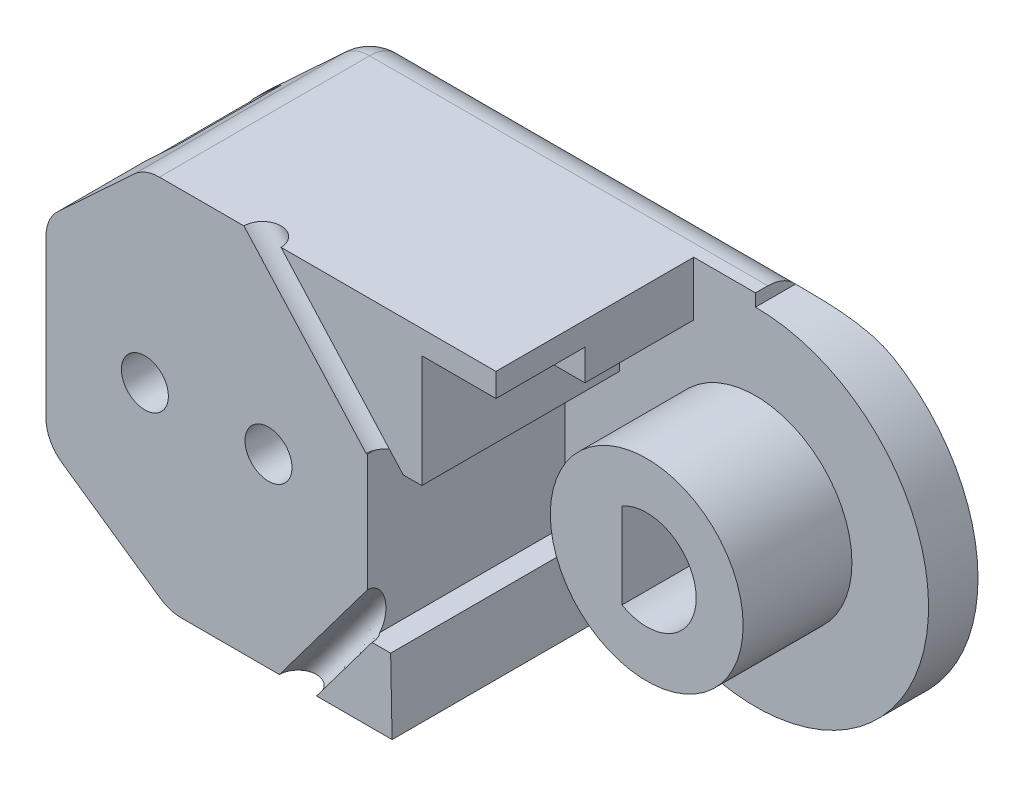
from build123d import *

# Parameters (mm, degrees)
BOSS_EXTRUDE1_DEPTH      = 2
BOSS_EXTRUDE2_DEPTH      = 8
SKETCH24_R               = 3.9
BOSS_EXTRUDE5_DEPTH      = 4.4
SKETCH30_W               = 4.40861202
SKETCH30_H               = 1.324178481
CUT_EXTRUDE12_DEPTH      = 16
CUT_EXTRUDE11_DEPTH      = 23.928148639
FILLET1_R                = 1.5
SKETCH34_R               = 0.75
CUT_EXTRUDE13_DEPTH      = 8
SKETCH35_R               = 0.75
CUT_EXTRUDE14_DEPTH      = 3
CUT_EXTRUDE14_DEPTH_BACK = 8
SKETCH36_R               = 0.95
CUT_EXTRUDE15_DEPTH      = 8
SKETCH37_R               = 2
CUT_EXTRUDE16_DEPTH      = 4.5
SKETCH38_W               = 3
SKETCH38_H               = 1.25
CUT_EXTRUDE17_DEPTH      = 3.6


with BuildPart() as part:
    # Sketch2 → Boss-Extrude1 (new body)
    with BuildSketch(Plane.XY):
        with BuildLine():
            Line((-2.5, 7.5), (-16.7, 7.5))
            Line((-16.7, 7.5), (-20.7, 3.793442666))
            Line((-20.7, 3.793442666), (-20.7, -4.031648778))
            Line((-20.7, -4.031648778), (-15.7, -7.5))
            Line((-15.7, -7.5), (-6.7, -7.5))
            Line((-6.7, -7.5), (-4.2, -5.6))
            ThreePointArc((-4.2, -5.6), (3.130495168, -6.260990337), (7, 0))
            ThreePointArc((7, 0), (4.949747468, 4.949747468), (0, 7))
            Line((0, 7), (0, 7.5))
            Line((0, 7.5), (-2.5, 7.5))
        make_face()
    extrude(amount=BOSS_EXTRUDE1_DEPTH)

    # Sketch4 → Boss-Extrude2 (add)
    with BuildSketch(Plane.XY.offset(2)):
        Polygon((-15.7, -7.5), (-6.7, -7.5), (-6.759079174, -4.5), (-7.7, -4.5), (-7.7, 2), (-5.5, 2), (-5.5, 5.3), (-2.5, 5.3), (-2.5, 7.5), (-16.7, 7.5), (-20.7, 3.793442666), (-20.7, -4.031648778), align=None)
    extrude(amount=BOSS_EXTRUDE2_DEPTH)

    # Sketch24 → Boss-Extrude5 (add)
    with BuildSketch(Plane.XY.offset(2)):
        Circle(SKETCH24_R)
    extrude(amount=BOSS_EXTRUDE5_DEPTH)

    # Sketch30 → Cut-Extrude12 (cut)
    with BuildSketch(Plane(origin=(-5.5, 0, 0), x_dir=(0, 0, -1), z_dir=(1, 0, 0))):
        with Locations((-4.20430601, 4.63791076)):
            Rectangle(SKETCH30_W, SKETCH30_H)
    extrude(amount=-CUT_EXTRUDE12_DEPTH, mode=Mode.SUBTRACT)

    # Sketch28 → Cut-Extrude11 (cut, through all)
    with BuildSketch(Plane.XY.offset(6.4)):
        with BuildLine():
            Line((-1, 1.732050808), (-1, -1.732050808))
            ThreePointArc((-1, -1.732050808), (2, 0), (-1, 1.732050808))
        make_face()
    extrude(amount=-CUT_EXTRUDE11_DEPTH, mode=Mode.SUBTRACT)

    # Fillet1
    # the kernel refuses this fillet: 1.5 mm, written as the material it takes off along each edge
    with BuildSketch(Plane(origin=(-15.230677435, -6, 1.5), x_dir=(-0.5699665637840448, -0.8216678867816415, 0), z_dir=(0, 0, -1))) as fillet1_piece_1_section:
        Polygon((0, 0), (FILLET1_R * 1.02, 0), (FILLET1_R * 1.02, -FILLET1_R * 0.319139344377), (FILLET1_R * 0.838101244517, -FILLET1_R * 0.58136589506), align=None)
    fillet1_piece_1 = extrude(amount=FILLET1_R * 1.02, mode=Mode.PRIVATE)
    fillet1_piece_1 = fillet1_piece_1 - Plane(origin=(-15.230677435, -6, 1.5), x_dir=(0.29860685961507855, 0.9543762064253388, 0), z_dir=(0, 0, -1)) * Sphere(FILLET1_R, mode=Mode.PRIVATE)
    add(fillet1_piece_1, mode=Mode.SUBTRACT)
    with BuildSketch(Plane(origin=(-16.11186344, 6, 1.5), x_dir=(-0.6796897201843015, 0.7334997506991983, 0), z_dir=(0, 0, -1))) as fillet1_piece_2_section:
        Polygon((0, 0), (FILLET1_R * 1.02, 0), (FILLET1_R * 1.02, FILLET1_R * 0.399932860855), (FILLET1_R * 0.748169745713, FILLET1_R * 0.693283514588), align=None)
    fillet1_piece_2 = extrude(amount=FILLET1_R * 1.02, mode=Mode.PRIVATE)
    fillet1_piece_2 = fillet1_piece_2 - Plane(origin=(-16.11186344, 6, 1.5), x_dir=(0.3650344157067945, -0.9309940254102596, 0), z_dir=(0, 0, -1)) * Sphere(FILLET1_R, mode=Mode.PRIVATE)
    add(fillet1_piece_2, mode=Mode.SUBTRACT)
    with BuildSketch(Plane(origin=(-19.2, 3.138411196, 1.5), x_dir=(-0.6796897201843015, 0.7334997506991983, 0), z_dir=(0, 0, -1))) as fillet1_piece_3_section:
        Polygon((0, 0), (FILLET1_R * 1.02, 0), (FILLET1_R * 1.02, -FILLET1_R * 0.445421399395), (FILLET1_R * 0.693283514588, -FILLET1_R * 0.748169745713), align=None)
    fillet1_piece_3 = extrude(amount=FILLET1_R * 1.02, mode=Mode.PRIVATE)
    fillet1_piece_3 = fillet1_piece_3 - Plane(origin=(-19.2, 3.138411196, 1.5), x_dir=(0.9164304993244992, -0.40019387789901173, 0), z_dir=(0, 0, -1)) * Sphere(FILLET1_R, mode=Mode.PRIVATE)
    add(fillet1_piece_3, mode=Mode.SUBTRACT)
    with BuildSketch(Plane(origin=(-19.2, -3.246599046, 1.5), x_dir=(-0.5699665637840448, -0.8216678867816415, 0), z_dir=(0, 0, -1))) as fillet1_piece_4_section:
        Polygon((0, 0), (FILLET1_R * 1.02, 0), (FILLET1_R * 1.02, FILLET1_R * 0.533833817771), (FILLET1_R * 0.58136589506, FILLET1_R * 0.838101244517), align=None)
    fillet1_piece_4 = extrude(amount=FILLET1_R * 1.02, mode=Mode.PRIVATE)
    fillet1_piece_4 = fillet1_piece_4 - Plane(origin=(-19.2, -3.246599046, 1.5), x_dir=(0.8859928227090906, 0.46369895202380795, 0), z_dir=(0, 0, -1)) * Sphere(FILLET1_R, mode=Mode.PRIVATE)
    add(fillet1_piece_4, mode=Mode.SUBTRACT)
    with BuildSketch(Plane(origin=(-15.230677435, -7.5, 0), x_dir=(0, 1, 0), z_dir=(1, 0, 0))) as fillet1_piece_5_section:
        with BuildLine():
            CenterArc((FILLET1_R, FILLET1_R), FILLET1_R, 180, 90)
            Line((0, FILLET1_R), (0, 0))
            Line((0, 0), (FILLET1_R, 0))
        make_face()
    fillet1_piece_5 = extrude(amount=12.280677435, mode=Mode.PRIVATE)
    fillet1_piece_5 = split(fillet1_piece_5, bisect_by=Plane(origin=(-9.092127217, -9.318016685, 0.3282266), z_dir=(-0.6050832675335577, 0.7961621941231027, 0)), keep=Keep.TOP, mode=Mode.PRIVATE)
    add(fillet1_piece_5, mode=Mode.SUBTRACT)
    with BuildSketch(Plane(origin=(3.75, 7.5, 0), x_dir=(0, 0, 1), z_dir=(-1, 0, 0))) as fillet1_piece_6:
        with BuildLine():
            CenterArc((FILLET1_R, -FILLET1_R), FILLET1_R, 90, 90)
            Line((0, -FILLET1_R), (0, 0))
            Line((0, 0), (FILLET1_R, 0))
        make_face()
    extrude(amount=19.86186344, mode=Mode.SUBTRACT)
    with BuildSketch(Plane(origin=(-17.13139802, 7.100249626, 0), x_dir=(0.6796897201843014, -0.7334997506991981, 0), z_dir=(-0.7334997506991983, -0.6796897201843015, 0))) as fillet1_piece_7:
        with BuildLine():
            CenterArc((FILLET1_R, FILLET1_R), FILLET1_R, 180, 90)
            Line((0, FILLET1_R), (0, 0))
            Line((0, 0), (FILLET1_R, 0))
        make_face()
    extrude(amount=4.21013989, mode=Mode.SUBTRACT)
    with BuildSketch(Plane(origin=(-20.054949846, -4.479100876, 0), x_dir=(0.5699665637840448, 0.8216678867816416, 0), z_dir=(0.8216678867816415, -0.5699665637840448, 0))) as fillet1_piece_8:
        with BuildLine():
            CenterArc((FILLET1_R, FILLET1_R), FILLET1_R, 180, 90)
            Line((0, FILLET1_R), (0, 0))
            Line((0, 0), (FILLET1_R, 0))
        make_face()
    extrude(amount=4.830811364, mode=Mode.SUBTRACT)
    with BuildSketch(Plane(origin=(-20.7, 3.138411196, 0), x_dir=(1, 0, 0), z_dir=(0, -1, 0))) as fillet1_piece_9:
        with BuildLine():
            CenterArc((FILLET1_R, FILLET1_R), FILLET1_R, 180, 90)
            Line((0, FILLET1_R), (0, 0))
            Line((0, 0), (FILLET1_R, 0))
        make_face()
    extrude(amount=6.385010242, mode=Mode.SUBTRACT)
    with BuildSketch(Plane(origin=(-15.7, -7.5, 1.5), x_dir=(1, 0, 0), z_dir=(0, 0, 1))) as fillet1_piece_10:
        with BuildLine():
            CenterArc((FILLET1_R * 0.312881710173, FILLET1_R), FILLET1_R, 235.252105822, 34.747894178)
            Line((-FILLET1_R * 0.257084853611, FILLET1_R * 0.178332113218), (0, 0))
            Line((0, 0), (FILLET1_R * 0.312881710173, 0))
        make_face()
    extrude(amount=9.673306413, mode=Mode.SUBTRACT)
    with BuildSketch(Plane(origin=(-20.7, -4.031648778, 1.5), x_dir=(0, 1, 0), z_dir=(0, 0, 1))) as fillet1_piece_11:
        with BuildLine():
            CenterArc((FILLET1_R * 0.523366488011, -FILLET1_R), FILLET1_R, 90, 55.252105822)
            Line((-FILLET1_R * 0.298301398771, -FILLET1_R * 0.430033436216), (0, 0))
            Line((0, 0), (FILLET1_R * 0.523366488011, 0))
        make_face()
    extrude(amount=10.46262433, mode=Mode.SUBTRACT)
    with BuildSketch(Plane(origin=(-20.7, 3.793442666, 1.5), x_dir=(0.7334997506991984, 0.6796897201843014, 0), z_dir=(0, 0, 1))) as fillet1_piece_12:
        with BuildLine():
            CenterArc((FILLET1_R * 0.436687646465, -FILLET1_R), FILLET1_R, 90, 47.18059856)
            Line((-FILLET1_R * 0.296812104234, -FILLET1_R * 0.320310279816), (0, 0))
            Line((0, 0), (FILLET1_R * 0.436687646465, 0))
        make_face()
    extrude(amount=10.137578674, mode=Mode.SUBTRACT)
    with BuildSketch(Plane(origin=(-16.7, 7.5, 1.5), x_dir=(1, 0, 0), z_dir=(0, 0, 1))) as fillet1_piece_13:
        with BuildLine():
            CenterArc((FILLET1_R * 0.392091040054, -FILLET1_R), FILLET1_R, 90, 42.81940144)
            Line((-FILLET1_R * 0.287598680131, -FILLET1_R * 0.266500249301), (0, 0))
            Line((0, 0), (FILLET1_R * 0.392091040054, 0))
        make_face()
    extrude(amount=9.9703414, mode=Mode.SUBTRACT)

    # Sketch34 → Cut-Extrude13 (cut, along a direction that is not the sketch's normal)
    with BuildSketch(Plane.XZ.offset(-2)):
        with Locations((-7, 10)):
            Circle(SKETCH34_R)
    extrude(amount=-CUT_EXTRUDE13_DEPTH, dir=(0.6685833876565112, -0.7436371788377336, 0), mode=Mode.SUBTRACT)

    # Sketch35 → Cut-Extrude14 (cut, two sides, along a direction that is not the sketch's normal)
    with BuildSketch(Plane(origin=(0, -4.5, 0), x_dir=(1, 0, 0), z_dir=(0, 1, 0))) as cut_extrude14_sk:
        with Locations((-8.259079174, -10)):
            Circle(SKETCH35_R)
    extrude(amount=CUT_EXTRUDE14_DEPTH, dir=(0.5999194182208608, 0.8000604299935998, 0), mode=Mode.SUBTRACT)
    extrude(cut_extrude14_sk.sketch, amount=-CUT_EXTRUDE14_DEPTH_BACK, dir=(0.5999194182208608, 0.8000604299935998, 0), mode=Mode.SUBTRACT)

    # Sketch36 → Cut-Extrude15 (cut)
    with BuildSketch(Plane.XY.offset(10)):
        with Locations((-11.7, 0)):
            Circle(SKETCH36_R)
        with Locations((-16.7, 0)):
            Circle(SKETCH36_R)
    extrude(amount=-CUT_EXTRUDE15_DEPTH, mode=Mode.SUBTRACT)

    # Sketch37 → Cut-Extrude16 (cut)
    with BuildSketch(Plane(origin=(0, 0, 0), x_dir=(-1, 0, 0), z_dir=(0, 0, -1))):
        with Locations((11.7, 0)):
            Circle(SKETCH37_R)
        with Locations((16.7, 0)):
            Circle(SKETCH37_R)
    extrude(amount=-CUT_EXTRUDE16_DEPTH, mode=Mode.SUBTRACT)

    # Sketch38 → Cut-Extrude17 (cut)
    with BuildSketch(Plane.XY.offset(10)):
        with Locations((-4, 5.925)):
            Rectangle(SKETCH38_W, SKETCH38_H)
    extrude(amount=-CUT_EXTRUDE17_DEPTH, mode=Mode.SUBTRACT)


solid = part.part
